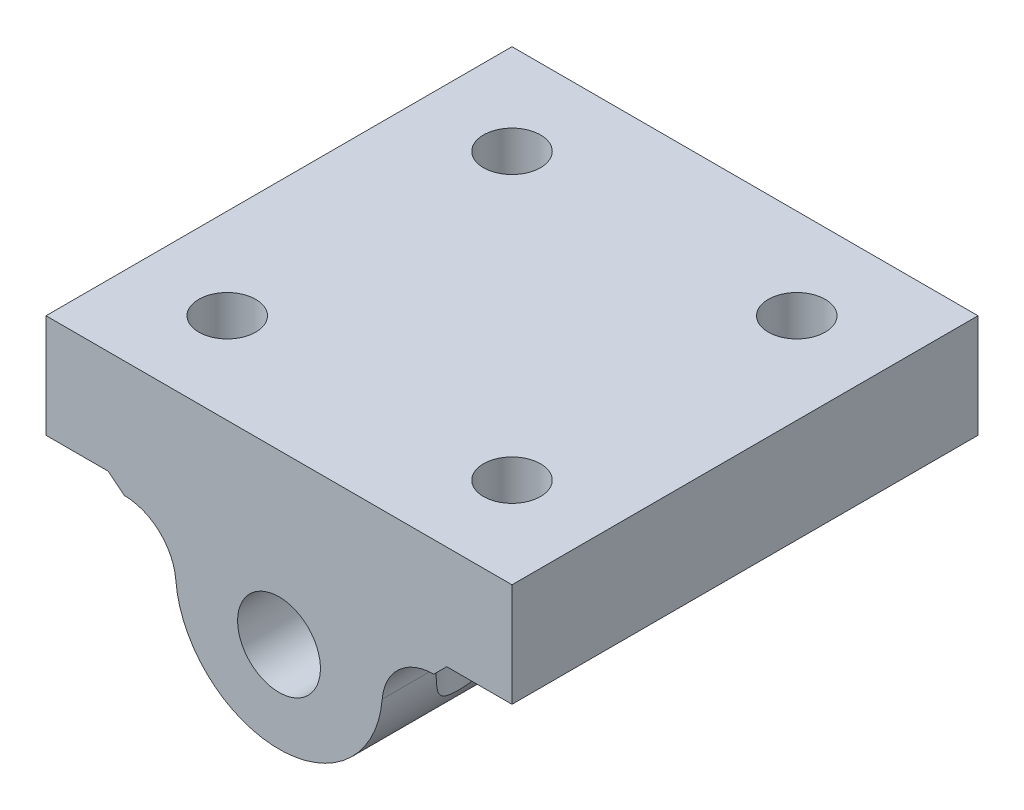
from build123d import *

# Parameters (mm, degrees)
SKETCH1_W            = 60
SKETCH1_H            = 42
BOSS_EXTRUDE1_DEPTH  = 8
SKETCH3_W            = 10
SKETCH3_H            = 42
BOSS_EXTRUDE5_DEPTH  = 6
SKETCH5_W            = 14
SKETCH5_H            = 42
BOSS_EXTRUDE6_DEPTH  = 11
SKETCH6_R            = 3.2
CUT_EXTRUDE1_DEPTH   = 75.565407529
FILLET1_R            = 7
FILLET2_R            = 5
FILLET3_R            = 5
BOSS_EXTRUDE7_DEPTH  = 42
SKETCH9_W            = 5
SKETCH9_H            = 42
BOSS_EXTRUDE8_DEPTH  = 6
SKETCH11_W           = 15
SKETCH11_H           = 42
CUT_EXTRUDE2_DEPTH   = 76.921011584
SKETCH12_W           = 30
SKETCH12_H           = 42
CUT_EXTRUDE3_DEPTH   = 6
SKETCH15_W           = 42
SKETCH15_H           = 8
BOSS_EXTRUDE9_DEPTH  = 5
SKETCH16_W           = 42
SKETCH16_H           = 8
BOSS_EXTRUDE10_DEPTH = 5
CUT_EXTRUDE7_START   = -17
CUT_EXTRUDE7_DEPTH   = 17
BOSS_EXTRUDE11_START = -5
SKETCH17_R           = 4.15
SKETCH17_R_2         = 2.2
BOSS_EXTRUDE11_DEPTH = 5
SKETCH18_W           = 2
SKETCH18_H           = 42
CUT_EXTRUDE8_DEPTH   = 67.392770772
CUT_EXTRUDE9_DEPTH   = 3
CUT_EXTRUDE10_START  = -3
CUT_EXTRUDE10_DEPTH  = 3


with BuildPart() as part:
    # Sketch1 → Boss-Extrude1 (new body)
    with BuildSketch(Plane(origin=(0, 0, 0), x_dir=(1, 0, 0), z_dir=(0, 1, 0))):
        with Locations((30, 21)):
            Rectangle(SKETCH1_W, SKETCH1_H)
    extrude(amount=BOSS_EXTRUDE1_DEPTH)

    # Sketch3 → Boss-Extrude5 (add)
    with BuildSketch(Plane(origin=(0, 8, 0), x_dir=(1, 0, 0), z_dir=(0, 1, 0))):
        with Locations((30, 21)):
            Rectangle(SKETCH3_W, SKETCH3_H)
    extrude(amount=BOSS_EXTRUDE5_DEPTH)

    # Sketch5 → Boss-Extrude6 (add)
    with BuildSketch(Plane.XZ):
        with Locations((30, -21)):
            Rectangle(SKETCH5_W, SKETCH5_H)
    extrude(amount=BOSS_EXTRUDE6_DEPTH)

    # Sketch6 → Cut-Extrude1 (cut, through all)
    with BuildSketch(Plane(origin=(0, 0, -42), x_dir=(-1, 0, 0), z_dir=(0, 0, -1))):
        with Locations((-30, -5)):
            Circle(SKETCH6_R)
    extrude(amount=-CUT_EXTRUDE1_DEPTH, mode=Mode.SUBTRACT)

    # Fillet1
    fillet1_edges = [part.edges().sort_by_distance(p)[0] for p in [
        (23, -11, -21),
        (37, -11, -21),
    ]]
    fillet(fillet1_edges, radius=FILLET1_R - 0.0001)  # a hair under: the kernel refuses the full size

    # Fillet2
    fillet2_edges = [part.edges().sort_by_distance(p)[0] for p in [
        (23, 0, -21),
    ]]
    fillet(fillet2_edges, radius=FILLET2_R)

    # Fillet3
    fillet3_edges = [part.edges().sort_by_distance(p)[0] for p in [
        (37, 0, -21),
    ]]
    fillet(fillet3_edges, radius=FILLET3_R)

    # Sketch8 → Boss-Extrude7 (add)
    with BuildSketch(Plane(origin=(0, 0, -42), x_dir=(-1, 0, 0), z_dir=(0, 0, -1))):
        with BuildLine():
            Line((-41.958260743, -1), (-42.958260743, 0))
            Line((-42.958260743, 0), (-41.958260743, 0))
            ThreePointArc((-41.958260743, 0), (-38.573244741, -1.320099639), (-36.9756521, -4.583333333))
            ThreePointArc((-36.9756521, -4.583333333), (-34.739022403, -9.151860505), (-30, -11))
            ThreePointArc((-30, -11), (-25.260977597, -9.151860505), (-23.0243479, -4.583333333))
            ThreePointArc((-23.0243479, -4.583333333), (-21.426755259, -1.320099639), (-18.041739257, 0))
            Line((-18.041739257, 0), (-16.803044796, 0))
            Line((-16.803044796, 0), (-18.041739257, -1))
            ThreePointArc((-18.041739257, -1), (-20.749752058, -2.056079711), (-22.027826171, -4.666666667))
            ThreePointArc((-22.027826171, -4.666666667), (-24.583974397, -9.887840578), (-30, -12))
            ThreePointArc((-30, -12), (-35.416025603, -9.887840578), (-37.972173829, -4.666666667))
            ThreePointArc((-37.972173829, -4.666666667), (-39.250247942, -2.056079711), (-41.958260743, -1))
        make_face()
    extrude(amount=-BOSS_EXTRUDE7_DEPTH)

    # Sketch9 → Boss-Extrude8 (add)
    with BuildSketch(Plane(origin=(0, 8, 0), x_dir=(1, 0, 0), z_dir=(0, 1, 0))):
        with Locations((42.5, 21)):
            Rectangle(SKETCH9_W, SKETCH9_H)
        with Locations((17.5, 21)):
            Rectangle(SKETCH9_W, SKETCH9_H)
    extrude(amount=BOSS_EXTRUDE8_DEPTH)

    # Sketch11 → Cut-Extrude2 (cut, through all)
    with BuildSketch(Plane(origin=(0, 8, 0), x_dir=(1, 0, 0), z_dir=(0, 1, 0))):
        with Locations((52.5, 21)):
            Rectangle(SKETCH11_W, SKETCH11_H)
        with Locations((7.5, 21)):
            Rectangle(SKETCH11_W, SKETCH11_H)
    extrude(amount=-CUT_EXTRUDE2_DEPTH, mode=Mode.SUBTRACT)

    # Sketch12 → Cut-Extrude3 (cut)
    with BuildSketch(Plane(origin=(0, 14, 0), x_dir=(1, 0, 0), z_dir=(0, 1, 0))):
        with Locations((30, 21)):
            Rectangle(SKETCH12_W, SKETCH12_H)
    extrude(amount=-CUT_EXTRUDE3_DEPTH, mode=Mode.SUBTRACT)

    # Sketch15 → Boss-Extrude9 (add)
    with BuildSketch(Plane.ZY.offset(-15)):
        with Locations((-21, 4)):
            Rectangle(SKETCH15_W, SKETCH15_H)
    extrude(amount=BOSS_EXTRUDE9_DEPTH)

    # Sketch16 → Boss-Extrude10 (add)
    with BuildSketch(Plane(origin=(45, 0, 0), x_dir=(0, 0, -1), z_dir=(1, 0, 0))):
        with Locations((21, 4)):
            Rectangle(SKETCH16_W, SKETCH16_H)
    extrude(amount=BOSS_EXTRUDE10_DEPTH)

    # Cut-Extrude7: read off the stored shape, not the designer's step
    # Cut-Extrude7 outline → Cut-Extrude7 (cut)
    with BuildSketch(Plane(origin=(0, 8, 0), x_dir=(1, 0, 0), z_dir=(0, 1, 0)).offset(CUT_EXTRUDE7_START)):
        with BuildLine():
            ThreePointArc((45, 33.105667219), (36.85, 32), (45, 30.894332781))
            Line((45, 30.894332781), (45, 33.105667219))
        make_face()
        with BuildLine():
            ThreePointArc((45, 11.105667219), (36.85, 10), (45, 8.894332781))
            Line((45, 8.894332781), (45, 11.105667219))
        make_face()
        with BuildLine():
            ThreePointArc((15, 8.894332781), (23.15, 10), (15, 11.105667219))
            Line((15, 11.105667219), (15, 8.894332781))
        make_face()
        with BuildLine():
            ThreePointArc((15, 30.894332781), (23.15, 32), (15, 33.105667219))
            Line((15, 33.105667219), (15, 30.894332781))
        make_face()
    extrude(amount=CUT_EXTRUDE7_DEPTH, mode=Mode.SUBTRACT)

    # Sketch17 → Boss-Extrude11 (add)
    # profile 1 of 4: a face of its own
    with BuildSketch(Plane(origin=(0, 8, 0), x_dir=(1, 0, 0), z_dir=(0, 1, 0)).offset(BOSS_EXTRUDE11_START)):
        with Locations((41, 32)):
            Circle(SKETCH17_R)
        with Locations(Location((41, 32, 0), (0, 0, 270))):
            Circle(SKETCH17_R_2, mode=Mode.SUBTRACT)
    # profile 2 of 4: a face of its own
    with BuildSketch(Plane(origin=(0, 8, 0), x_dir=(1, 0, 0), z_dir=(0, 1, 0)).offset(BOSS_EXTRUDE11_START)):
        with Locations((19, 10)):
            Circle(SKETCH17_R)
        with Locations(Location((19, 10, 0), (0, 0, 270))):
            Circle(SKETCH17_R_2, mode=Mode.SUBTRACT)
    # profile 3 of 4: a face of its own
    with BuildSketch(Plane(origin=(0, 8, 0), x_dir=(1, 0, 0), z_dir=(0, 1, 0)).offset(BOSS_EXTRUDE11_START)):
        with Locations((41, 10)):
            Circle(SKETCH17_R)
        with Locations(Location((41, 10, 0), (0, 0, 270))):
            Circle(SKETCH17_R_2, mode=Mode.SUBTRACT)
    # profile 4 of 4: a face of its own
    with BuildSketch(Plane(origin=(0, 8, 0), x_dir=(1, 0, 0), z_dir=(0, 1, 0)).offset(BOSS_EXTRUDE11_START)):
        with Locations((19, 32)):
            Circle(SKETCH17_R)
        with Locations(Location((19, 32, 0), (0, 0, 270))):
            Circle(SKETCH17_R_2, mode=Mode.SUBTRACT)
    extrude(amount=BOSS_EXTRUDE11_DEPTH)

    # Sketch18 → Cut-Extrude8 (cut, through all)
    with BuildSketch(Plane.XZ):
        with Locations((11, -21)):
            Rectangle(SKETCH18_W, SKETCH18_H)
        with Locations((49, -21)):
            Rectangle(SKETCH18_W, SKETCH18_H)
    extrude(amount=-CUT_EXTRUDE8_DEPTH, mode=Mode.SUBTRACT)

    # Sketch20 → Cut-Extrude9 (cut)
    with BuildSketch(Plane(origin=(0, 0, -42), x_dir=(-1, 0, 0), z_dir=(0, 0, -1))):
        with BuildLine():
            Line((-16.803044796, 0), (-12, 0))
            Line((-12, 0), (-12, 8))
            Line((-12, 8), (-48, 8))
            Line((-48, 8), (-48, 0))
            Line((-48, 0), (-42.958260743, 0))
            Line((-42.958260743, 0), (-41.958260743, -1))
            ThreePointArc((-41.958260743, -1), (-39.250247942, -2.056079711), (-37.972173829, -4.666666667))
            ThreePointArc((-37.972173829, -4.666666667), (-30, -12), (-22.027826171, -4.666666667))
            ThreePointArc((-22.027826171, -4.666666667), (-20.749752058, -2.056079711), (-18.041739257, -1))
            Line((-18.041739257, -1), (-16.803044796, 0))
        make_face()
    extrude(amount=-CUT_EXTRUDE9_DEPTH, mode=Mode.SUBTRACT)

    # Sketch19 → Cut-Extrude10 (cut)
    with BuildSketch(Plane.XY.offset(CUT_EXTRUDE10_START)):
        with BuildLine():
            Line((48, 8), (12, 8))
            Line((12, 8), (12, 0))
            Line((12, 0), (16.803044796, 0))
            Line((16.803044796, 0), (18.041739257, -1))
            ThreePointArc((18.041739257, -1), (20.749752058, -2.056079711), (22.027826171, -4.666666667))
            ThreePointArc((22.027826171, -4.666666667), (30, -12), (37.972173829, -4.666666667))
            ThreePointArc((37.972173829, -4.666666667), (39.250247942, -2.056079711), (41.958260743, -1))
            Line((41.958260743, -1), (42.958260743, 0))
            Line((42.958260743, 0), (48, 0))
            Line((48, 0), (48, 8))
        make_face()
    extrude(amount=CUT_EXTRUDE10_DEPTH, mode=Mode.SUBTRACT)


solid = part.part
